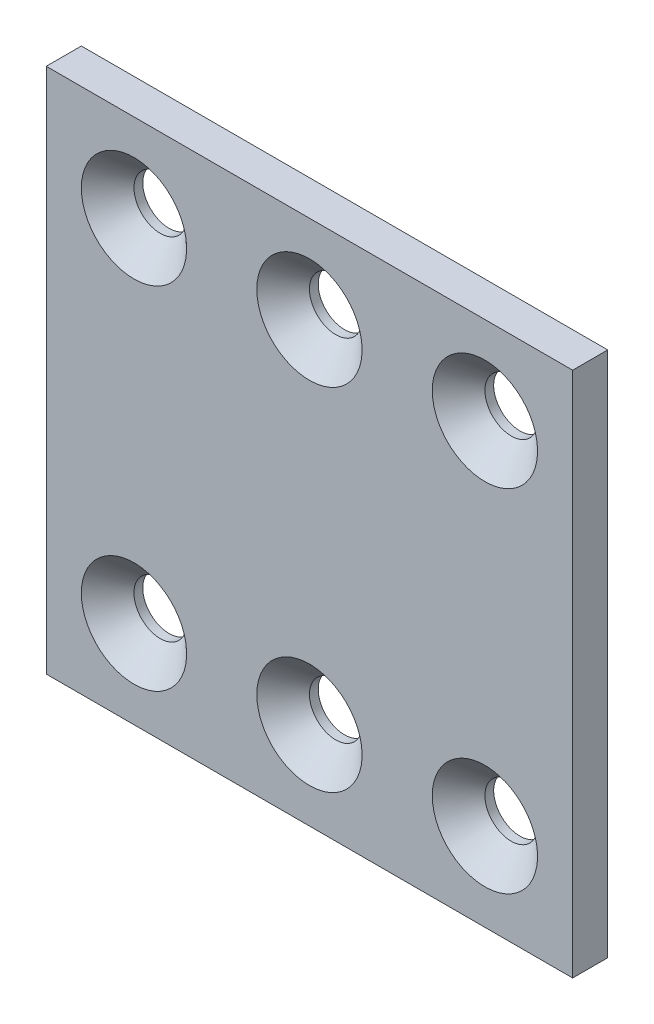
from build123d import *

# Parameters (mm, degrees)
SKETCH1_W           = 60
SKETCH1_H           = 60
BOSS_EXTRUDE1_DEPTH = 2
SKETCH2_R           = 3
CUT_EXTRUDE1_DEPTH  = 43.614551505
CHAMFER1_SIZE       = 3


with BuildPart() as part:
    # Sketch1 → Boss-Extrude1 (new, symmetric)
    with BuildSketch(Plane.XY):
        Rectangle(SKETCH1_W, SKETCH1_H)
    extrude(amount=BOSS_EXTRUDE1_DEPTH, both=True)

    # Sketch2 → Cut-Extrude1 (cut, through all)
    with BuildSketch(Plane.XY.offset(2)):
        with Locations((0, 20)):
            Circle(SKETCH2_R)
        with Locations((0, -20)):
            Circle(SKETCH2_R)
        with Locations((20, -20)):
            Circle(SKETCH2_R)
        with Locations((-20, -20)):
            Circle(SKETCH2_R)
        with Locations((-20, 20)):
            Circle(SKETCH2_R)
        with Locations((20, 20)):
            Circle(SKETCH2_R)
    extrude(amount=-CUT_EXTRUDE1_DEPTH, mode=Mode.SUBTRACT)

    # Chamfer1
    chamfer1_edges = [part.edges().sort_by_distance(p)[0] for p in [
        (17, -20, 2),
        (-3, -20, 2),
        (-23, -20, 2),
        (17, 20, 2),
        (-3, 20, 2),
        (-23, 20, 2),
    ]]
    chamfer(chamfer1_edges, length=CHAMFER1_SIZE)


solid = part.part
